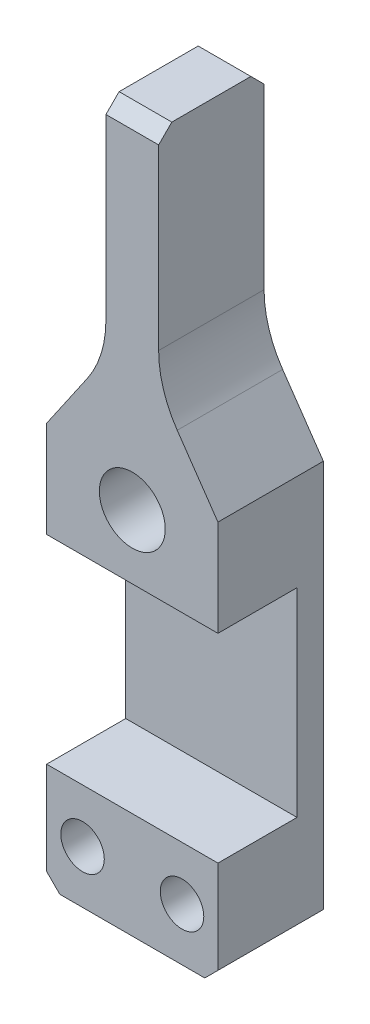
from build123d import *

# Parameters (mm, degrees)
ESQUISSE1_W                             = 13
ESQUISSE1_H                             = 55
BOSS_EXTRU_1_DEPTH                      = 8
TROUS_DE_CENTRAGE_5_0MMTRANSITIONAL_1_D = 5
ESQUISSE4_W                             = 4.5
ESQUISSE4_H                             = 20
ENL_V_MAT_EXTRU_1_DEPTH                 = 30.368350311
CONG_1_R                                = 2
CHANFREIN1_SIZE                         = 1
TROU_TARAUD_M41_D                       = 3.3
CHANFREIN2_START                        = -1
CHANFREIN2_DEPTH                        = 10
ESQUISSE9_W                             = 8
ESQUISSE9_H                             = 8
ENL_V_MAT_EXTRU_2_DEPTH                 = 30.874738493
ESQUISSE10_W                            = 4
ESQUISSE10_H                            = 8
BOSS_EXTRU_2_DEPTH                      = 7
CHANFREIN3_SIZE                         = 1
BOSS_EXTRU_3_START                      = -8
BOSS_EXTRU_3_DEPTH                      = 8
CONG_2_R                                = 8
ESQUISSE12_W                            = 6.001123603
ESQUISSE12_H                            = 15.09853113
ENL_V_MAT_EXTRU_3_DEPTH                 = 32.452345059


with BuildPart() as part:
    # Esquisse1 → Boss.-Extru.1 (new body)
    with BuildSketch(Plane.XY):
        Rectangle(ESQUISSE1_W, ESQUISSE1_H)
    extrude(amount=BOSS_EXTRU_1_DEPTH)

    # Trous de centrage Ø5.0mmTransitional 1 (through all)
    with Locations(Plane.XY.offset(8)):
        with Locations((0, 0.5)):
            Hole(TROUS_DE_CENTRAGE_5_0MMTRANSITIONAL_1_D / 2)

    # Esquisse4 → Enlèv. mat.-Extru.1 (cut, through all)
    with BuildSketch(Plane.XY.offset(8)):
        with Locations((4.25, 17.5)):
            Rectangle(ESQUISSE4_W, ESQUISSE4_H)
        with Locations((-4.25, 17.5)):
            Rectangle(ESQUISSE4_W, ESQUISSE4_H)
    extrude(amount=-ENL_V_MAT_EXTRU_1_DEPTH, mode=Mode.SUBTRACT)

    # Congé1
    cong_1_edges = [part.edges().sort_by_distance(p)[0] for p in [
        (2, 7.5, 4),
        (-2, 7.5, 4),
    ]]
    fillet(cong_1_edges, radius=CONG_1_R)

    # Chanfrein1
    chanfrein1_edges = [part.edges().sort_by_distance(p)[0] for p in [
        (6.5, -27.5, 4),
        (-6.5, -27.5, 4),
    ]]
    chamfer(chanfrein1_edges, length=CHANFREIN1_SIZE)

    # Trou taraudé M41 (through all)
    with Locations(Plane.XY.offset(8)):
        with Locations((-3.775, -23.5), (3.775, -23.5)):
            Hole(TROU_TARAUD_M41_D / 2)

    # Chanfrein2: read off the stored shape, not the designer's step
    # Chanfrein2 outline → Chanfrein2 (cut)
    with BuildSketch(Plane.XY.offset(CHANFREIN2_START)):
        with BuildLine():
            Line((3.285714286, 7.631900453), (6.5, 2.961651585))
            Line((6.5, 2.961651585), (6.5, 7.5))
            Line((6.5, 7.5), (4, 7.5))
            ThreePointArc((4, 7.5), (3.636818981, 7.533251529), (3.285714286, 7.631900453))
        make_face()
        with BuildLine():
            Line((-6.5, 2.961651585), (-3.285714286, 7.631900453))
            ThreePointArc((-3.285714286, 7.631900453), (-3.636818981, 7.533251529), (-4, 7.5))
            Line((-4, 7.5), (-6.5, 7.5))
            Line((-6.5, 7.5), (-6.5, 2.961651585))
        make_face()
    extrude(amount=CHANFREIN2_DEPTH, mode=Mode.SUBTRACT)

    # Esquisse9 → Enlèv. mat.-Extru.2 (cut, through all)
    with BuildSketch(Plane.ZY.offset(2)):
        with Locations((4, 23.5)):
            Rectangle(ESQUISSE9_W, ESQUISSE9_H)
    extrude(amount=-ENL_V_MAT_EXTRU_2_DEPTH, mode=Mode.SUBTRACT)

    # Esquisse10 → Boss.-Extru.2 (add)
    with BuildSketch(Plane(origin=(0, 19.5, 0), x_dir=(1, 0, 0), z_dir=(0, 1, 0))):
        with Locations((0, -4)):
            Rectangle(ESQUISSE10_W, ESQUISSE10_H)
    extrude(amount=BOSS_EXTRU_2_DEPTH)

    # Chanfrein3
    chanfrein3_edges = [part.edges().sort_by_distance(p)[0] for p in [
        (0, 26.5, 0),
        (0, 26.5, 8),
    ]]
    chamfer(chanfrein3_edges, length=CHANFREIN3_SIZE)

    # Esquisse11 → Boss.-Extru.3 (add)
    with BuildSketch(Plane.XY.offset(8).offset(BOSS_EXTRU_3_START)):
        with BuildLine():
            Line((-3.285714286, 7.631900453), (-2, 9.5))
            ThreePointArc((-2, 9.5), (-2.352491058, 8.366106581), (-3.285714286, 7.631900453))
        make_face()
        with BuildLine():
            Line((3.285714286, 7.631900453), (2, 9.5))
            ThreePointArc((2, 9.5), (2.352491058, 8.366106581), (3.285714286, 7.631900453))
        make_face()
    extrude(amount=BOSS_EXTRU_3_DEPTH)

    # Congé2
    cong_2_edges = [part.edges().sort_by_distance(p)[0] for p in [
        (-2, 9.5, 4),
        (2, 9.5, 4),
    ]]
    fillet(cong_2_edges, radius=CONG_2_R)

    # Esquisse12 → Enlèv. mat.-Extru.3 (cut, through all)
    with BuildSketch(Plane(origin=(6.5, 0, 0), x_dir=(0, 0, -1), z_dir=(1, 0, 0))):
        with Locations((-4.999438199, -11.898438915)):
            Rectangle(ESQUISSE12_W, ESQUISSE12_H)
    extrude(amount=-ENL_V_MAT_EXTRU_3_DEPTH, mode=Mode.SUBTRACT)


solid = part.part
